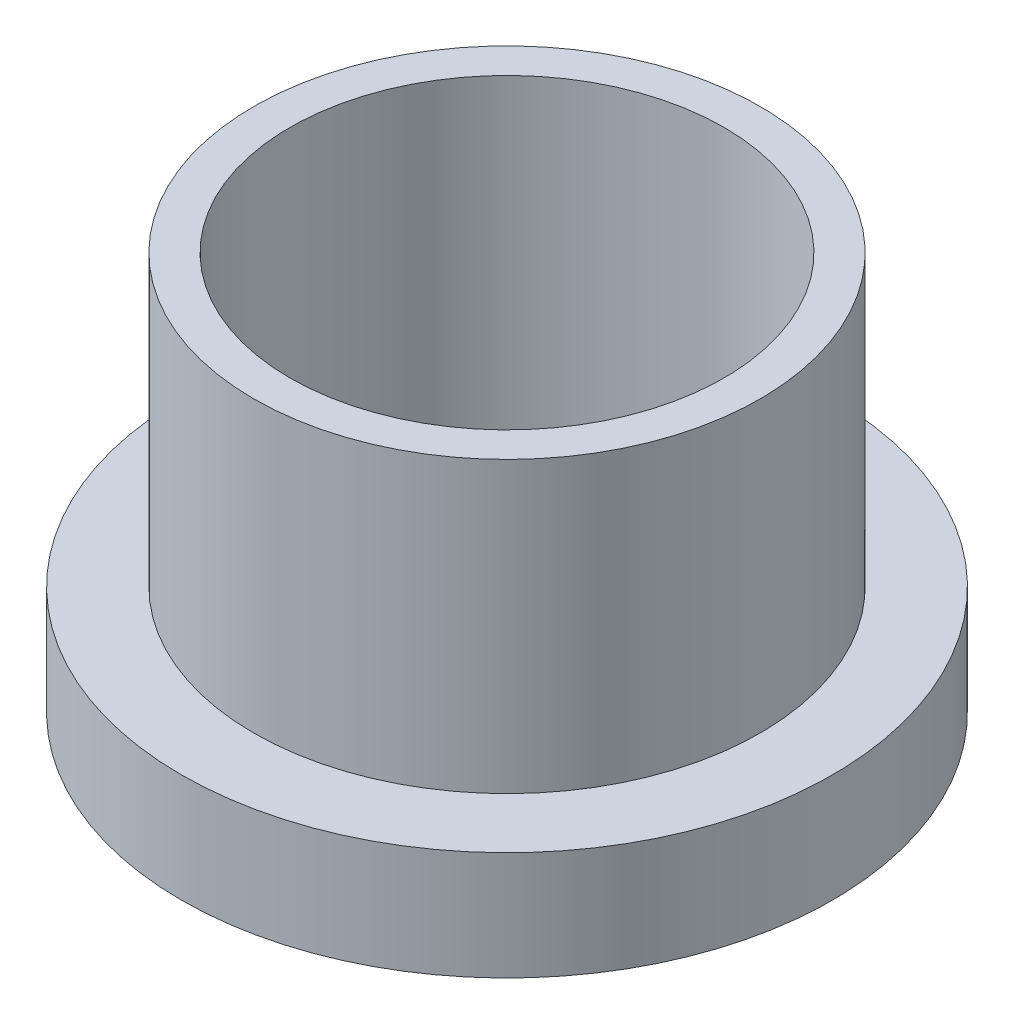
from build123d import *

# Parameters (mm, degrees)
SKETCH1_R           = 9
BOSS_EXTRUDE1_DEPTH = 3
SKETCH2_R           = 7
BOSS_EXTRUDE2_DEPTH = 8
SKETCH3_R           = 6
CUT_EXTRUDE1_DEPTH  = 17.822603841


with BuildPart() as part:
    # Sketch1 → Boss-Extrude1 (new body)
    with BuildSketch(Plane(origin=(0, 0, 0), x_dir=(1, 0, 0), z_dir=(0, 1, 0))):
        Circle(SKETCH1_R)
    extrude(amount=BOSS_EXTRUDE1_DEPTH)

    # Sketch2 → Boss-Extrude2 (add)
    with BuildSketch(Plane(origin=(0, 3, 0), x_dir=(1, 0, 0), z_dir=(0, 1, 0))):
        Circle(SKETCH2_R)
    extrude(amount=BOSS_EXTRUDE2_DEPTH)

    # Sketch3 → Cut-Extrude1 (cut, through all)
    with BuildSketch(Plane(origin=(0, 11, 0), x_dir=(1, 0, 0), z_dir=(0, 1, 0))):
        Circle(SKETCH3_R)
    extrude(amount=-CUT_EXTRUDE1_DEPTH, mode=Mode.SUBTRACT)


solid = part.part
